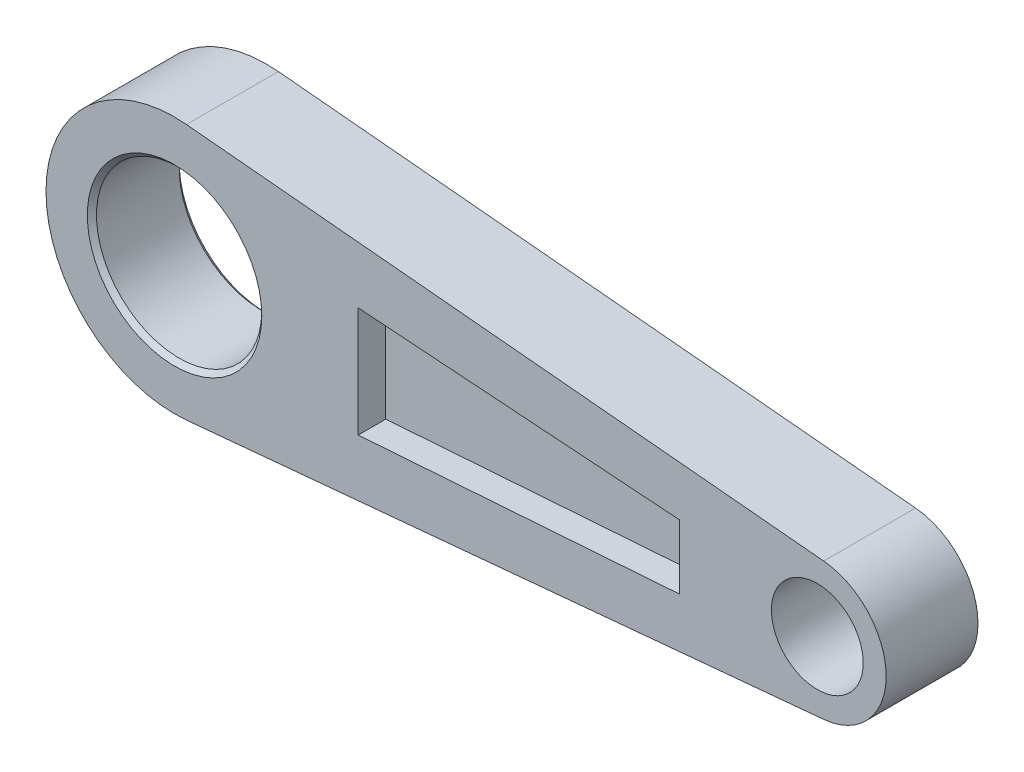
from build123d import *

# Parameters (mm, degrees)
EXTRUDE_START       = -10
EXTRUDE_1_DEPTH     = 20
SKETCH_2_R          = 18
CUT_EXTRUDE_1_DEPTH = 159.773423469
SKETCH_3_R          = 10
CUT_EXTRUDE_2_DEPTH = 159.773423469
CUT_EXTRUDE_3_DEPTH = 6
CUT_EXTRUDE_4_DEPTH = 6
CHAMFER_1_SIZE      = 1
SKETCH_7_R          = 2
CUT_EXTRUDE_6_DEPTH = 25


# Read off the part's stored shape, not the designer's step: 凸台-拉伸1
with BuildPart() as part:
    # 凸台-拉伸1 outline → 凸台-拉伸1 (new body)
    with BuildSketch(Plane.XY.offset(EXTRUDE_START)):
        with BuildLine():
            ThreePointArc((2.6, 27.879024373), (-28, 0), (2.6, -27.879024373))
            Line((2.6, -27.879024373), (141.392857143, -14.935191628))
            ThreePointArc((141.392857143, -14.935191628), (155, 0), (141.392857143, 14.935191628))
            Line((141.392857143, 14.935191628), (2.6, 27.879024373))
        make_face()
    extrude(amount=EXTRUDE_1_DEPTH)

    # 草图2 → 切除-拉伸1 (cut, through all)
    with BuildSketch(Plane.XY.offset(10)):
        Circle(SKETCH_2_R)
    extrude(amount=-CUT_EXTRUDE_1_DEPTH, mode=Mode.SUBTRACT)

    # 草图3 → 切除-拉伸2 (cut, through all)
    with BuildSketch(Plane.XY.offset(10)):
        with Locations((140, 0)):
            Circle(SKETCH_3_R)
    extrude(amount=-CUT_EXTRUDE_2_DEPTH, mode=Mode.SUBTRACT)

    # 草图4 → 切除-拉伸3 (cut)
    with BuildSketch(Plane.XY.offset(10)):
        Polygon((40, -12), (40, 12), (110, 7), (110, -7), align=None)
    extrude(amount=-CUT_EXTRUDE_3_DEPTH, mode=Mode.SUBTRACT)

    # 草图5 → 切除-拉伸4 (cut)
    with BuildSketch(Plane.XY.offset(-10)):
        Polygon((40, -12), (40, 12), (110, 7), (110, -7), align=None)
    extrude(amount=CUT_EXTRUDE_4_DEPTH, mode=Mode.SUBTRACT)

    # 倒角1
    chamfer_1_edges = [part.edges().sort_by_distance(p)[0] for p in [
        (-18, 0, -10),
        (-18, 0, 10),
    ]]
    chamfer(chamfer_1_edges, length=CHAMFER_1_SIZE)

    # 草图7 → 切除-拉伸6 (cut)
    with BuildSketch(Plane(origin=(25, 0, 0), x_dir=(0, 0, -1), z_dir=(1, 0, 0))):
        Circle(SKETCH_7_R)
    extrude(amount=-CUT_EXTRUDE_6_DEPTH, mode=Mode.SUBTRACT)


solid = part.part
